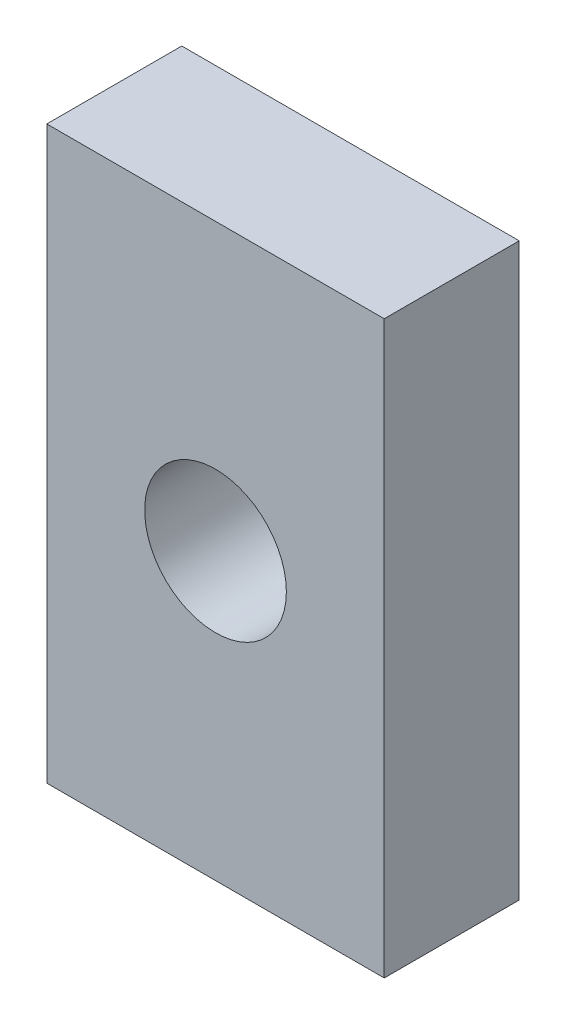
from build123d import *

# Parameters (mm, degrees)
SKETCH1_W           = 25
SKETCH1_H           = 42.3
SKETCH1_R           = 5.25
BOSS_EXTRUDE1_DEPTH = 10


with BuildPart() as part:
    # Sketch1 → Boss-Extrude1 (new body)
    with BuildSketch(Plane.XY):
        Rectangle(SKETCH1_W, SKETCH1_H)
        Circle(SKETCH1_R, mode=Mode.SUBTRACT)
    extrude(amount=BOSS_EXTRUDE1_DEPTH)


solid = part.part
